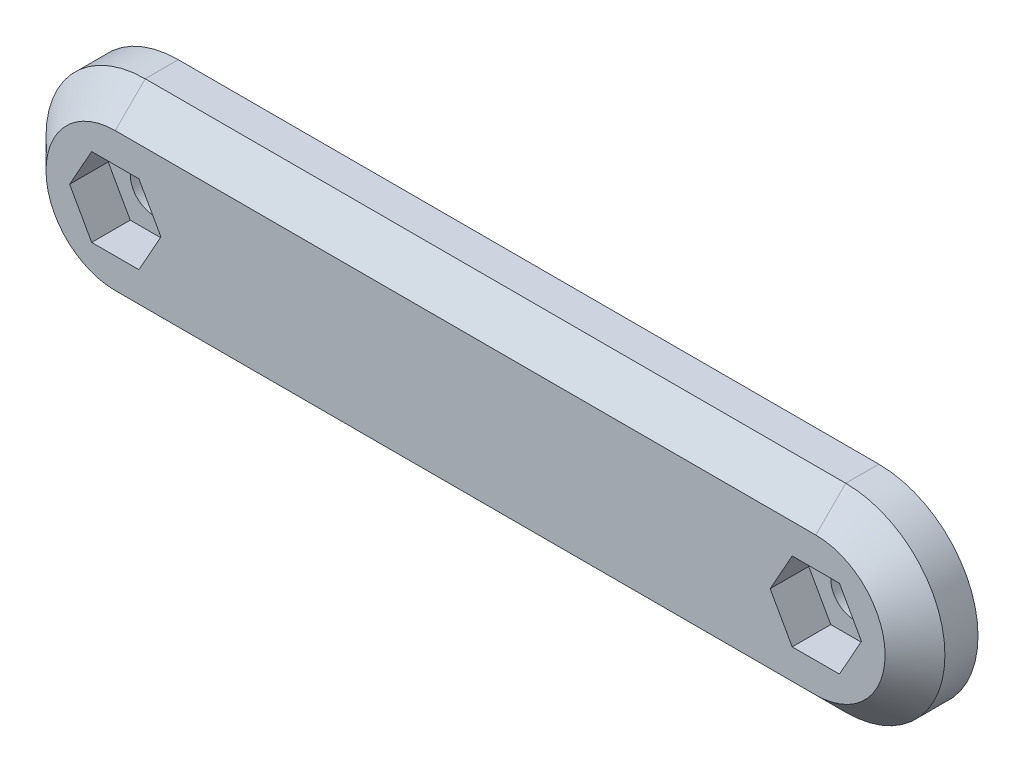
from build123d import *

# Parameters (mm, degrees)
BOSS_EXTRUDE1_DEPTH  = 4.5
BOSS_EXTRUDE2_DEPTH  = 4
CHAMFER2_2_DEPTH     = 4.2
CHAMFER2_START       = 4.2
CHAMFER2_3_OUTLINE_R = 8.8
CHAMFER2_3_DEPTH     = 3.8
SKETCH4_R            = 3
CUT_EXTRUDE1_DEPTH   = 103.673405573
CUT_EXTRUDE2_DEPTH   = 4.9
CUT_EXTRUDE3_DEPTH   = 5


with BuildPart() as part:
    # Sketch2 → Boss-Extrude1 (new body)
    with BuildSketch(Plane.XY):
        with BuildLine():
            Line((0, 12.6), (88.98281443, 12.6))
            ThreePointArc((88.98281443, 12.6), (101.58281443, 0), (88.98281443, -12.6))
            Line((88.98281443, -12.6), (0, -12.6))
            ThreePointArc((0, -12.6), (-12.6, 0), (0, 12.6))
        make_face()
    extrude(amount=BOSS_EXTRUDE1_DEPTH)

    # Sketch3 → Boss-Extrude2 (add)
    with BuildSketch(Plane.XY.offset(8)):
        with BuildLine():
            Line((-0.708592785, -8.85), (89.691407215, -8.85))
            ThreePointArc((89.691407215, -8.85), (98.541407215, 0), (89.691407215, 8.85))
            Line((89.691407215, 8.85), (-0.708592785, 8.85))
            ThreePointArc((-0.708592785, 8.85), (-9.558592785, 0), (-0.708592785, -8.85))
        make_face()
    extrude(amount=-BOSS_EXTRUDE2_DEPTH)

    # Chamfer2: read off the stored shape, not the designer's step
    # Chamfer2 outline → Chamfer2 (revolve)
    with BuildSketch(Plane(origin=(88.98281443, 0, 0), x_dir=(1, 0, 0), z_dir=(0, -1, 0))):
        Polygon((12.6, 4.2), (8.8, 8), (8.8, 4.2), align=None)
    revolve(axis=Axis((88.98281443, 0, 0), (0, 0, 1)))

    # Chamfer2 2 outline → Chamfer2 2 (add)
    with BuildSketch(Plane.XY):
        with BuildLine():
            ThreePointArc((0, 12.6), (-12.6, 0), (0, -12.6))
            Line((0, -12.6), (88.98281443, -12.6))
            ThreePointArc((88.98281443, -12.6), (101.58281443, 0), (88.98281443, 12.6))
            Line((88.98281443, 12.6), (0, 12.6))
        make_face()
    extrude(amount=CHAMFER2_2_DEPTH)

    # Chamfer2 3 outline → Chamfer2 3 (add)
    with BuildSketch(Plane.XY.offset(CHAMFER2_START)):
        with Locations((88.98281443, 0)):
            Circle(CHAMFER2_3_OUTLINE_R)
    extrude(amount=CHAMFER2_3_DEPTH)

    # Chamfer2 4: loft between two sections, ruled curve by curve
    chamfer2_4_from = [
        Edge.make_three_point_arc((0, -8.8, 8), (-6.222539674, -6.222539674, 8), (-8.8, 0, 8)),
        Edge.make_three_point_arc((-8.8, 0, 8), (-6.222539674, 6.222539674, 8), (0, 8.8, 8)),
        Edge.make_line((88.98281443, 8.8, 8), (0, 8.8, 8)),
        Edge.make_line((0, -8.8, 8), (88.98281443, -8.8, 8)),
        Edge.make_line((88.98281443, -8.8, 8), (88.98281443, 8.8, 8)),
    ]
    chamfer2_4_to = [
        Edge.make_three_point_arc((0, -12.6, 4.2), (-8.909545443, -8.909545443, 4.2), (-12.6, 0, 4.2)),
        Edge.make_three_point_arc((-12.6, 0, 4.2), (-8.909545443, 8.909545443, 4.2), (0, 12.6, 4.2)),
        Edge.make_line((88.98281443, 12.6, 4.2), (0, 12.6, 4.2)),
        Edge.make_line((0, -12.6, 4.2), (88.98281443, -12.6, 4.2)),
        Edge.make_line((88.98281443, -12.6, 4.2), (88.98281443, 12.6, 4.2)),
    ]
    chamfer2_4 = Solid(Shell([*[Face.make_surface_from_curves(chamfer2_4_from[k], chamfer2_4_to[k]) for k in range(5)], Face(Wire(chamfer2_4_from)), Face(Wire(chamfer2_4_to))]))
    add(chamfer2_4)

    # Sketch4 → Cut-Extrude1 (cut, through all)
    with BuildSketch(Plane.XY):
        with Locations((88.98281443, 0)):
            Circle(SKETCH4_R)
        Circle(SKETCH4_R)
    extrude(amount=CUT_EXTRUDE1_DEPTH, mode=Mode.SUBTRACT)

    # Sketch5 → Cut-Extrude2 (cut)
    with BuildSketch(Plane.XY.offset(8)):
        Polygon((3, -5), (-3, -5), (-5.8, 0), (-3, 5), (3, 5), (5.8, 0), align=None)
        Polygon((83.18281443, 0), (85.98281443, 5), (91.98281443, 5), (94.78281443, 0), (91.98281443, -5), (85.98281443, -5), align=None)
    extrude(amount=-CUT_EXTRUDE2_DEPTH, mode=Mode.SUBTRACT)

    # Sketch6 → Cut-Extrude3 (cut)
    with BuildSketch(Plane.XY):
        with BuildLine():
            Line((70.338627057, 7.052928589), (72.459947401, 4.931608246))
            Line((72.459947401, 4.931608246), (67.492805249, -0.035533906))
            ThreePointArc((67.492805249, -0.035533906), (65.870688505, -1.119397663), (63.957271343, -1.5))
            Line((63.957271343, -1.5), (55.182814215, -1.5))
            Line((55.182814215, -1.5), (55.182814215, -3.5))
            Line((55.182814215, -3.5), (52.382814215, -3.5))
            Line((52.382814215, -3.5), (52.382814215, -1.5))
            Line((52.382814215, -1.5), (45.961101061, -1.5))
            ThreePointArc((45.961101061, -1.5), (44.491407215, -2.1), (43.021713369, -1.5))
            Line((43.021713369, -1.5), (26.268183774, -1.5))
            ThreePointArc((26.268183774, -1.5), (24.354766612, -1.880602337), (22.732649868, -2.964466094))
            Line((22.732649868, -2.964466094), (18.644187373, -7.052928589))
            Line((18.644187373, -7.052928589), (16.522867029, -4.931608246))
            Line((16.522867029, -4.931608246), (21.490009181, 0.035533906))
            ThreePointArc((21.490009181, 0.035533906), (23.112125925, 1.119397663), (25.025543087, 1.5))
            Line((25.025543087, 1.5), (43.021713369, 1.5))
            ThreePointArc((43.021713369, 1.5), (44.491407215, 2.1), (45.961101061, 1.5))
            Line((45.961101061, 1.5), (62.714630656, 1.5))
            ThreePointArc((62.714630656, 1.5), (64.628047818, 1.880602337), (66.250164562, 2.964466094))
            Line((66.250164562, 2.964466094), (70.338627057, 7.052928589))
        make_face()
    extrude(amount=CUT_EXTRUDE3_DEPTH, mode=Mode.SUBTRACT)


solid = part.part
